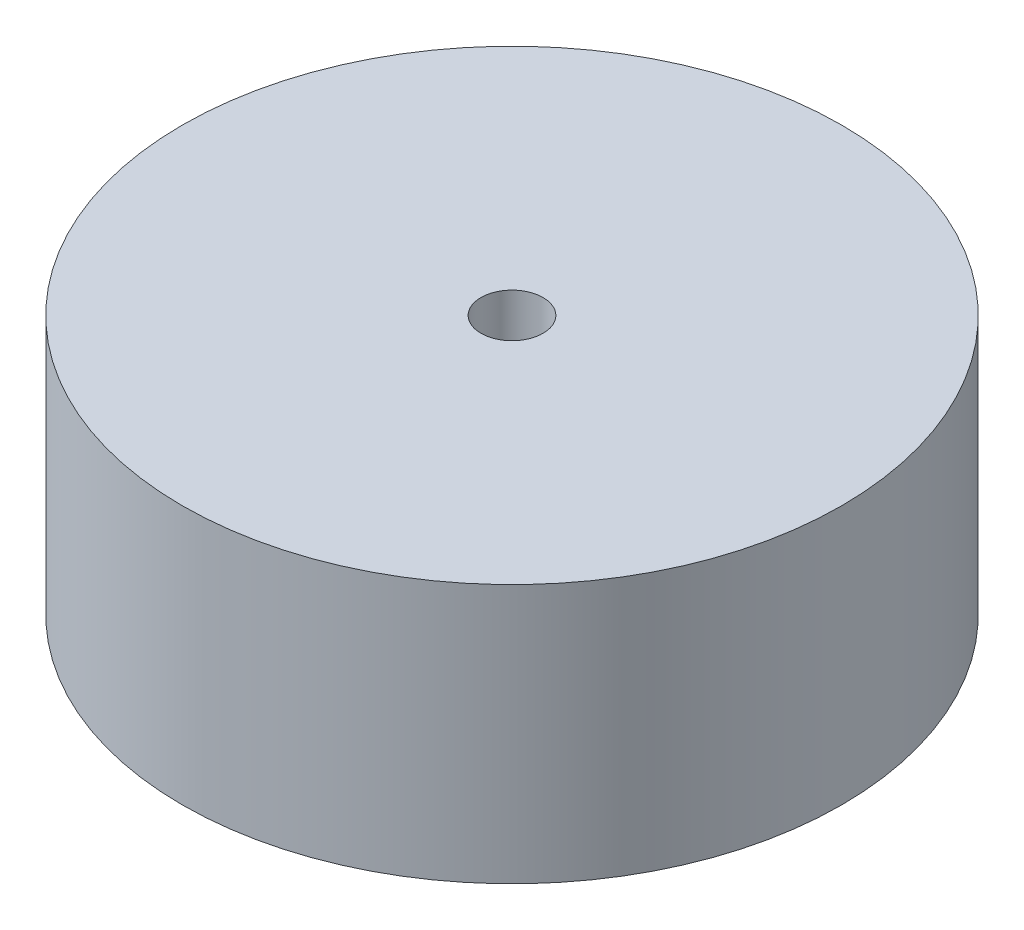
from build123d import *

# Parameters (mm, degrees)
SKETCH_1_R      = 42.5
SKETCH_1_R_2    = 4
EXTRUDE_1_DEPTH = 33.4


with BuildPart() as part:
    # 草圖1 → 填料-伸長1 (new body)
    with BuildSketch(Plane(origin=(0, 0, 0), x_dir=(1, 0, 0), z_dir=(0, 1, 0))):
        Circle(SKETCH_1_R)
        Circle(SKETCH_1_R_2, mode=Mode.SUBTRACT)
    extrude(amount=EXTRUDE_1_DEPTH)


solid = part.part
